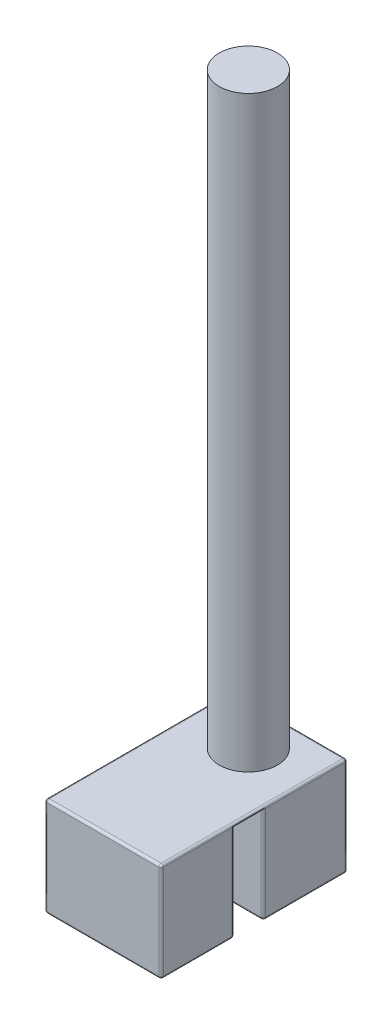
from build123d import *

# Parameters (mm, degrees)
SKETCH1_W           = 100
SKETCH1_H           = 160
BOSS_EXTRUDE1_DEPTH = 85
SKETCH2_R           = 25
BOSS_EXTRUDE2_DEPTH = 590
SKETCH3_W           = 25
SKETCH3_H           = 82
CUT_EXTRUDE1_DEPTH  = 70
FILLET2_R           = 2
FILLET3_R           = 5
FILLET4_R           = 2


with BuildPart() as part:
    # Sketch1 → Boss-Extrude1 (new body)
    with BuildSketch(Plane(origin=(0, 0, 0), x_dir=(1, 0, 0), z_dir=(0, 1, 0))):
        with Locations((-10.009659714, -61.441979522)):
            Rectangle(SKETCH1_W, SKETCH1_H)
    extrude(amount=BOSS_EXTRUDE1_DEPTH)

    # Sketch2 → Boss-Extrude2 (add)
    with BuildSketch(Plane(origin=(0, 0, 0), x_dir=(1, 0, 0), z_dir=(0, 1, 0))):
        with Locations(Location((-10.009659714, -16.441979522, 0), (0, 0, 270))):
            Circle(SKETCH2_R)
    extrude(amount=BOSS_EXTRUDE2_DEPTH)

    # Sketch3 → Cut-Extrude1 (cut)
    with BuildSketch(Plane(origin=(39.990340286, 0, 0), x_dir=(0, 0, -1), z_dir=(1, 0, 0))):
        with Locations((-66.178079743, 41)):
            Rectangle(SKETCH3_W, SKETCH3_H)
    extrude(amount=-CUT_EXTRUDE1_DEPTH, mode=Mode.SUBTRACT)

    # Fillet2
    fillet2_edges = [part.edges().sort_by_distance(p)[0] for p in [
        (39.990340286, 41, 53.678079743),
        (39.990340286, 82, 66.178079743),
        (39.990340286, 41, 78.678079743),
    ]]
    fillet(fillet2_edges, radius=FILLET2_R)

    # Fillet3
    fillet3_edges = [part.edges().sort_by_distance(p)[0] for p in [
        (-30.009659714, 82, 66.178079743),
    ]]
    fillet(fillet3_edges, radius=FILLET3_R)

    # Fillet4
    # the kernel refuses this fillet: 2 mm, written as the material it takes off along each edge
    with BuildSketch(Plane(origin=(-58.009659714, 83, -16.558020478), x_dir=(0, 0, -1), z_dir=(-1, 0, 0))) as fillet4_piece_1_section:
        Polygon((0, 0), (FILLET4_R, 0), (FILLET4_R, -FILLET4_R), (0, -FILLET4_R), align=None)
    fillet4_piece_1 = extrude(amount=FILLET4_R, mode=Mode.PRIVATE)
    fillet4_piece_1 = fillet4_piece_1 - Plane(origin=(-58.009659714, 83, -16.558020478), x_dir=(0, -0.7071067811865475, 0.7071067811865475), z_dir=(-1, 0, 0)) * Sphere(FILLET4_R, mode=Mode.PRIVATE)
    add(fillet4_piece_1, mode=Mode.SUBTRACT)
    with BuildSketch(Plane(origin=(37.990340286, 83, -16.558020478), x_dir=(0, 1, 0), z_dir=(0, 0, -1))) as fillet4_piece_2_section:
        Polygon((0, 0), (FILLET4_R, 0), (FILLET4_R, FILLET4_R), (0, FILLET4_R), align=None)
    fillet4_piece_2 = extrude(amount=FILLET4_R, mode=Mode.PRIVATE)
    fillet4_piece_2 = fillet4_piece_2 - Plane(origin=(37.990340286, 83, -16.558020478), x_dir=(-0.7071067811865475, -0.7071067811865475, 0), z_dir=(0, 0, -1)) * Sphere(FILLET4_R, mode=Mode.PRIVATE)
    add(fillet4_piece_2, mode=Mode.SUBTRACT)
    with BuildSketch(Plane(origin=(-58.009659714, 2, -16.558020478), x_dir=(0, 0, -1), z_dir=(-1, 0, 0))) as fillet4_piece_3_section:
        Polygon((0, 0), (FILLET4_R, 0), (FILLET4_R, FILLET4_R), (0, FILLET4_R), align=None)
    fillet4_piece_3 = extrude(amount=FILLET4_R, mode=Mode.PRIVATE)
    fillet4_piece_3 = fillet4_piece_3 - Plane(origin=(-58.009659714, 2, -16.558020478), x_dir=(0, 0.7071067811865475, 0.7071067811865475), z_dir=(-1, 0, 0)) * Sphere(FILLET4_R, mode=Mode.PRIVATE)
    add(fillet4_piece_3, mode=Mode.SUBTRACT)
    with BuildSketch(Plane(origin=(37.990340286, 2, -16.558020478), x_dir=(0, -1, 0), z_dir=(0, 0, -1))) as fillet4_piece_4_section:
        Polygon((0, 0), (FILLET4_R, 0), (FILLET4_R, -FILLET4_R), (0, -FILLET4_R), align=None)
    fillet4_piece_4 = extrude(amount=FILLET4_R, mode=Mode.PRIVATE)
    fillet4_piece_4 = fillet4_piece_4 - Plane(origin=(37.990340286, 2, -16.558020478), x_dir=(-0.7071067811865475, 0.7071067811865475, 0), z_dir=(0, 0, -1)) * Sphere(FILLET4_R, mode=Mode.PRIVATE)
    add(fillet4_piece_4, mode=Mode.SUBTRACT)
    with BuildSketch(Plane(origin=(37.990340286, 2, 139.441979522), x_dir=(0, -1, 0), z_dir=(0, 0, 1))) as fillet4_piece_5_section:
        Polygon((0, 0), (FILLET4_R, 0), (FILLET4_R, FILLET4_R), (0, FILLET4_R), align=None)
    fillet4_piece_5 = extrude(amount=FILLET4_R, mode=Mode.PRIVATE)
    fillet4_piece_5 = fillet4_piece_5 - Plane(origin=(37.990340286, 2, 139.441979522), x_dir=(-0.7071067811865475, 0.7071067811865475, 0), z_dir=(0, 0, 1)) * Sphere(FILLET4_R, mode=Mode.PRIVATE)
    add(fillet4_piece_5, mode=Mode.SUBTRACT)
    with BuildSketch(Plane(origin=(37.990340286, 83, 139.441979522), x_dir=(0, 1, 0), z_dir=(0, 0, 1))) as fillet4_piece_6_section:
        Polygon((0, 0), (FILLET4_R, 0), (FILLET4_R, -FILLET4_R), (0, -FILLET4_R), align=None)
    fillet4_piece_6 = extrude(amount=FILLET4_R, mode=Mode.PRIVATE)
    fillet4_piece_6 = fillet4_piece_6 - Plane(origin=(37.990340286, 83, 139.441979522), x_dir=(-0.7071067811865475, -0.7071067811865475, 0), z_dir=(0, 0, 1)) * Sphere(FILLET4_R, mode=Mode.PRIVATE)
    add(fillet4_piece_6, mode=Mode.SUBTRACT)
    with BuildSketch(Plane(origin=(-58.009659714, 83, 139.441979522), x_dir=(-1, 0, 0), z_dir=(0, 0, 1))) as fillet4_piece_7_section:
        Polygon((0, 0), (FILLET4_R, 0), (FILLET4_R, -FILLET4_R), (0, -FILLET4_R), align=None)
    fillet4_piece_7 = extrude(amount=FILLET4_R, mode=Mode.PRIVATE)
    fillet4_piece_7 = fillet4_piece_7 - Plane(origin=(-58.009659714, 83, 139.441979522), x_dir=(0.7071067811865475, -0.7071067811865475, 0), z_dir=(0, 0, 1)) * Sphere(FILLET4_R, mode=Mode.PRIVATE)
    add(fillet4_piece_7, mode=Mode.SUBTRACT)
    with BuildSketch(Plane(origin=(-58.009659714, 2, 139.441979522), x_dir=(-1, 0, 0), z_dir=(0, 0, 1))) as fillet4_piece_8_section:
        Polygon((0, 0), (FILLET4_R, 0), (FILLET4_R, FILLET4_R), (0, FILLET4_R), align=None)
    fillet4_piece_8 = extrude(amount=FILLET4_R, mode=Mode.PRIVATE)
    fillet4_piece_8 = fillet4_piece_8 - Plane(origin=(-58.009659714, 2, 139.441979522), x_dir=(0.7071067811865475, 0.7071067811865475, 0), z_dir=(0, 0, 1)) * Sphere(FILLET4_R, mode=Mode.PRIVATE)
    add(fillet4_piece_8, mode=Mode.SUBTRACT)
    with BuildSketch(Plane(origin=(37.990340286, 0, 53.678079743), x_dir=(0, 0, -1), z_dir=(-1, 0, 0)), Plane(origin=(37.990340286, 0, 78.678079743), x_dir=(0, 1, 0), z_dir=(-1, 0, 0))) as fillet4_piece_9:
        with BuildLine():
            CenterArc((FILLET4_R, -FILLET4_R), FILLET4_R, 90, 90)
            Line((0, -FILLET4_R), (0, 0))
            Line((0, 0), (FILLET4_R, 0))
        make_face()
    extrude(amount=68, mode=Mode.SUBTRACT)
    with BuildSketch(Plane(origin=(37.990340286, 0, 51.678079743), x_dir=(1, 0, 0), z_dir=(0, 0, -1))) as fillet4_piece_10:
        with BuildLine():
            CenterArc((2 - FILLET4_R, -FILLET4_R), FILLET4_R, 0, 90)
            Line((2, -FILLET4_R), (2, 0))
            Line((2, 0), (2 - FILLET4_R, 0))
        make_face()
    revolve(axis=Axis((37.990340286, 0, 51.678079743), (0, -1, 0)), revolution_arc=90, mode=Mode.SUBTRACT)
    with BuildSketch(Plane(origin=(37.990340286, 0, 80.678079743), x_dir=(1, 0, 0), z_dir=(0, 0, 1))) as fillet4_piece_11:
        with BuildLine():
            CenterArc((2 - FILLET4_R, FILLET4_R), FILLET4_R, 270, 90)
            Line((2, FILLET4_R), (2, 0))
            Line((2, 0), (2 - FILLET4_R, 0))
        make_face()
    revolve(axis=Axis((37.990340286, 0, 80.678079743), (0, 1, 0)), revolution_arc=90, mode=Mode.SUBTRACT)
    with BuildSketch(Plane(origin=(-58.009659714, 85, -18.558020478), x_dir=(0, -1, 0), z_dir=(1, 0, 0)), Plane(origin=(-58.009659714, 0, -18.558020478), x_dir=(0, 0, 1), z_dir=(1, 0, 0)), Plane(origin=(37.990340286, 85, 141.441979522), x_dir=(0, -1, 0), z_dir=(-1, 0, 0)), Plane(origin=(37.990340286, 0, 141.441979522), x_dir=(0, 0, -1), z_dir=(-1, 0, 0))) as fillet4_piece_12:
        with BuildLine():
            CenterArc((FILLET4_R, -FILLET4_R), FILLET4_R, 90, 90)
            Line((0, -FILLET4_R), (0, 0))
            Line((0, 0), (FILLET4_R, 0))
        make_face()
    extrude(amount=96, mode=Mode.SUBTRACT)
    with BuildSketch(Plane(origin=(-60.009659714, 2, -18.558020478), x_dir=(0, 0, 1), z_dir=(0, 1, 0)), Plane(origin=(39.990340286, 2, 141.441979522), x_dir=(0, 0, -1), z_dir=(0, 1, 0)), Plane(origin=(-60.009659714, 2, 141.441979522), x_dir=(1, 0, 0), z_dir=(0, 1, 0))) as fillet4_piece_13:
        with BuildLine():
            CenterArc((FILLET4_R, FILLET4_R), FILLET4_R, 180, 90)
            Line((0, FILLET4_R), (0, 0))
            Line((0, 0), (FILLET4_R, 0))
        make_face()
    extrude(amount=81, mode=Mode.SUBTRACT)
    with BuildSketch(Plane(origin=(39.990340286, 0, -16.558020478), x_dir=(-1, 0, 0), z_dir=(0, 0, 1))) as fillet4_piece_14:
        with BuildLine():
            CenterArc((FILLET4_R, -FILLET4_R), FILLET4_R, 90, 90)
            Line((0, -FILLET4_R), (0, 0))
            Line((0, 0), (FILLET4_R, 0))
        make_face()
    extrude(amount=68.236100221, mode=Mode.SUBTRACT)
    with BuildSketch(Plane(origin=(39.990340286, 0, 80.678079743), x_dir=(-1, 0, 0), z_dir=(0, 0, 1))) as fillet4_piece_15:
        with BuildLine():
            CenterArc((FILLET4_R, -FILLET4_R), FILLET4_R, 90, 90)
            Line((0, -FILLET4_R), (0, 0))
            Line((0, 0), (FILLET4_R, 0))
        make_face()
    extrude(amount=58.763899779, mode=Mode.SUBTRACT)
    with BuildSketch(Plane(origin=(39.990340286, 2, -18.558020478), x_dir=(0, 0, 1), z_dir=(0, 1, 0))) as fillet4_piece_16:
        with BuildLine():
            CenterArc((FILLET4_R, -FILLET4_R), FILLET4_R, 90, 90)
            Line((0, -FILLET4_R), (0, 0))
            Line((0, 0), (FILLET4_R, 0))
        make_face()
    extrude(amount=81, mode=Mode.SUBTRACT)
    with BuildSketch(Plane(origin=(39.990340286, 85, -16.558020478), x_dir=(0, -1, 0), z_dir=(0, 0, 1)), Plane(origin=(-60.009659714, 0, 139.441979522), x_dir=(1, 0, 0), z_dir=(0, 0, -1)), Plane(origin=(-60.009659714, 85, 139.441979522), x_dir=(0, -1, 0), z_dir=(0, 0, -1))) as fillet4_piece_17:
        with BuildLine():
            CenterArc((FILLET4_R, -FILLET4_R), FILLET4_R, 90, 90)
            Line((0, -FILLET4_R), (0, 0))
            Line((0, 0), (FILLET4_R, 0))
        make_face()
    extrude(amount=156, mode=Mode.SUBTRACT)


solid = part.part
